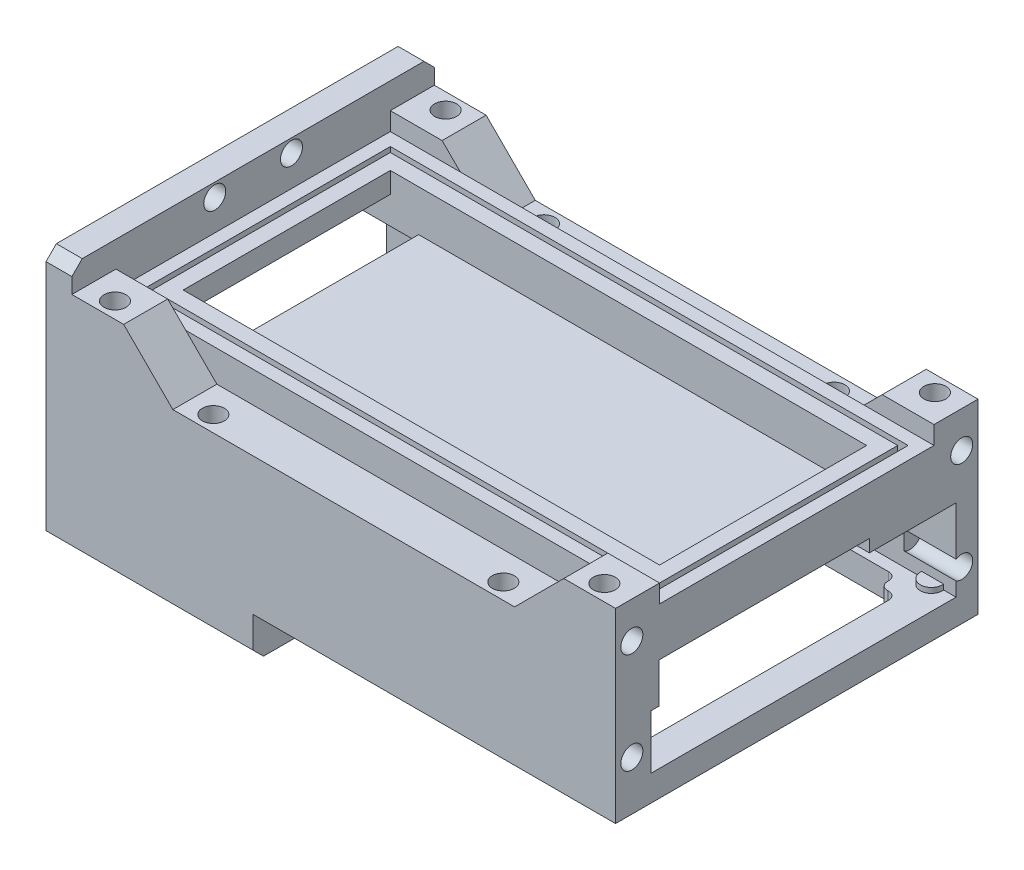
from build123d import *

# Parameters (mm, degrees)
BOSS_EXTRUDE1_DEPTH       = 70
SKETCH2_W                 = 53
SKETCH2_H                 = 3.5
CUT_EXTRUDE1_DEPTH        = 130.827770527
BOSS_EXTRUDE2_REACH       = 133.367
SKETCH3_W                 = 78
SKETCH3_H                 = 53
SKETCH4_W                 = 92
SKETCH4_H                 = 40
CUT_EXTRUDE2_DEPTH        = 8
CUT_EXTRUDE3_DEPTH        = 2
SKETCH6_W                 = 70
SKETCH6_H                 = 70
SKETCH6_W_2               = 44.924728749
SKETCH6_H_2               = 57.926731513
CUT_EXTRUDE4_DEPTH        = 9
CUT_EXTRUDE5_DEPTH        = 51
CUT_EXTRUDE6_REACH        = 131.946
CUT_EXTRUDE8_DEPTH        = 40
SKETCH12_W                = 70
SKETCH12_H                = 70
BOSS_EXTRUDE11_DEPTH      = 5
SKETCH13_R                = 2.125
CUT_EXTRUDE9_DEPTH        = 5
FILLET1_R                 = 1.5
SKETCH17_W                = 28
SKETCH17_H                = 16
CUT_EXTRUDE13_DEPTH       = 33
CUT_EXTRUDE14_DEPTH       = 2
FILLET2_R                 = 7.5
SKETCH19_W                = 70
SKETCH19_H                = 45
BOSS_EXTRUDE12_DEPTH      = 5
SKETCH20_W                = 40
SKETCH20_H                = 70
BOSS_EXTRUDE13_DEPTH      = 4
CHAMFER1_SIZE             = 2
SKETCH21_R                = 2.125
CUT_EXTRUDE15_DEPTH       = 5
SKETCH22_W                = 7.781971329
SKETCH22_H                = 26.560018154
BOSS_EXTRUDE14_DEPTH      = 14.5
SKETCH23_R                = 1.00000254
SKETCH23_W                = 2.87059736
SKETCH23_H                = 4.480571313
CUT_EXTRUDE16_DEPTH       = 5
CHAMFER2_SIZE             = 10
CHAMFER2_SIZE_2           = 14.4
CHAMFER3_SIZE             = 6
SKETCH24_R                = 2.125
CUT_EXTRUDE17_DEPTH       = 10
BOSS_EXTRUDE15_DEPTH      = 0.1
BOSS_EXTRUDE15_DEPTH_BACK = 1
SKETCH25_R                = 2.125
CUT_EXTRUDE18_START       = -9.5
SKETCH26_R                = 2.125
CUT_EXTRUDE18_DEPTH       = 5
SKETCH26_3_R              = 2.125
CUT_EXTRUDE19_DEPTH       = 5


with BuildPart() as part:
    # Sketch1 → Boss-Extrude1 (new body)
    with BuildSketch(Plane.XY):
        Polygon((-105, 9.5), (-95, 9.5), (-85.5, 0), (-19.5, 0), (-10, 9.5), (0, 9.5), (0, -30.5), (-105, -30.5), align=None)
    extrude(amount=-BOSS_EXTRUDE1_DEPTH)

    # Sketch2 → Cut-Extrude1 (cut, through all)
    with BuildSketch(Plane(origin=(0, 0, 0), x_dir=(0, 0, -1), z_dir=(1, 0, 0))):
        with Locations((35, 7.75)):
            Rectangle(SKETCH2_W, SKETCH2_H)
    extrude(amount=-CUT_EXTRUDE1_DEPTH, mode=Mode.SUBTRACT)

    # Sketch3 → Boss-Extrude2 (add, up to next)
    with BuildSketch(Plane(origin=(0, 6, 0), x_dir=(1, 0, 0), z_dir=(0, 1, 0)), mode=Mode.PRIVATE) as boss_extrude2_sk1:
        with Locations((-52.5, 35)):
            Rectangle(SKETCH3_W, SKETCH3_H)
    boss_extrude2_tool1 = extrude(boss_extrude2_sk1.sketch, amount=-BOSS_EXTRUDE2_REACH, mode=Mode.PRIVATE) - part.part
    add(boss_extrude2_tool1.solids().sort_by_distance((-52.5, 6, -35))[0])

    # Sketch4 → Cut-Extrude2 (cut)
    with BuildSketch(Plane(origin=(0, 6, 0), x_dir=(1, 0, 0), z_dir=(0, 1, 0))):
        with Locations((-52.5, 35)):
            Rectangle(SKETCH4_W, SKETCH4_H)
    extrude(amount=-CUT_EXTRUDE2_DEPTH, mode=Mode.SUBTRACT)

    # Sketch5 → Cut-Extrude3 (cut)
    with BuildSketch(Plane(origin=(0, 6, 0), x_dir=(1, 0, 0), z_dir=(0, 1, 0))):
        Polygon((-102.5, 11), (-91.5, 11), (-13.5, 11), (-2.5, 11), (-2.5, 59), (-13.5, 59), (-91.5, 59), (-102.5, 59), align=None)
        Polygon((-101.5, 12), (-91.5, 12), (-13.5, 12), (-3.5, 12), (-3.5, 58), (-13.5, 58), (-91.5, 58), (-101.5, 58), align=None, mode=Mode.SUBTRACT)
    extrude(amount=-CUT_EXTRUDE3_DEPTH, mode=Mode.SUBTRACT)

    # Sketch6 → Cut-Extrude4 (cut)
    # profile 1 of 2: a face of its own
    with BuildSketch(Plane(origin=(0, -30.5, 0), x_dir=(-1, 0, 0), z_dir=(0, -1, 0))):
        with Locations((35, 35)):
            Rectangle(SKETCH6_W, SKETCH6_H)
        with Locations((35.301172937, 35.02206094)):
            Rectangle(SKETCH6_W_2, SKETCH6_H_2, mode=Mode.SUBTRACT)
    # profile 2 of 2: a face of its own
    with BuildSketch(Plane(origin=(0, -30.5, 0), x_dir=(-1, 0, 0), z_dir=(0, -1, 0))):
        with Locations((35.301172937, 35.02206094)):
            Rectangle(SKETCH6_W_2, SKETCH6_H_2)
    extrude(amount=-CUT_EXTRUDE4_DEPTH, mode=Mode.SUBTRACT)

    # Sketch7 → Cut-Extrude5 (cut)
    with BuildSketch(Plane(origin=(0, 0, 0), x_dir=(0, 0, -1), z_dir=(1, 0, 0))):
        Polygon((65.756107057, -5.728262706), (49.01732031, -5.728262706), (49.01732031, -3.324369007), (8.399381402, -3.324369007), (8.399381402, -11.046594058), (6.843174338, -11.046594058), (6.843174338, -21.5), (65.756107057, -21.5), align=None)
    extrude(amount=-CUT_EXTRUDE5_DEPTH, mode=Mode.SUBTRACT)

    # Cut-Extrude6: up to this face of the body (flat: up to its plane)
    cut_extrude6_end = Plane(part.part.faces().sort_by_distance((-25.5, -3.324369007, -28.708350856))[0])
    # Sketch9 → Cut-Extrude6 (cut, up to the picked face)
    with BuildSketch(Plane.XZ.offset(21.5), mode=Mode.PRIVATE) as cut_extrude6_sk1:
        Polygon((-51, -6.843174338), (-73.873270861, -6.843174338), (-105, -6.843174338), (-105, -65.75), (-51, -65.75), align=None)
    cut_extrude6_tool1 = split(extrude(cut_extrude6_sk1.sketch, amount=-CUT_EXTRUDE6_REACH, mode=Mode.PRIVATE), bisect_by=cut_extrude6_end, keep=Keep.BOTH, mode=Mode.PRIVATE)
    add(cut_extrude6_tool1.solids().sort_by(Axis((-78, -21.5, -36.296587), (0, 1, 0)))[0], mode=Mode.SUBTRACT)

    # Sketch11 → Cut-Extrude8 (cut)
    with BuildSketch(Plane(origin=(0, 0, -15), x_dir=(-1, 0, 0), z_dir=(0, 0, -1))):
        Polygon((105, -2.637595748), (98.5, 2), (98.5, -2), (93.028116341, -2), (93.028116341, -11.163), (105, -11.163), align=None)
    extrude(amount=CUT_EXTRUDE8_DEPTH, mode=Mode.SUBTRACT)

    # Sketch12 → Boss-Extrude11 (add)
    with BuildSketch(Plane.XZ.offset(21.5)):
        with Locations((-35, -35)):
            Rectangle(SKETCH12_W, SKETCH12_H)
        Polygon((-59.75, -60.25), (-63, -60.25), (-63, -9.75), (-59.75, -9.75), (-59.75, -6.5), (-9.25, -6.5), (-9.25, -9.75), (-6, -9.75), (-6, -60.25), (-9.25, -60.25), (-9.25, -63.5), (-59.75, -63.5), align=None, mode=Mode.SUBTRACT)
    extrude(amount=BOSS_EXTRUDE11_DEPTH)

    # Sketch13 → Cut-Extrude9 (cut)
    with BuildSketch(Plane.XZ.offset(26.5)):
        with Locations((-65.5, -4.5)):
            Circle(SKETCH13_R)
        with Locations((-65.5, -65.5)):
            Circle(SKETCH13_R)
        with Locations((-4.5, -65.5)):
            Circle(SKETCH13_R)
        with Locations((-4.5, -4.5)):
            Circle(SKETCH13_R)
    extrude(amount=-CUT_EXTRUDE9_DEPTH, mode=Mode.SUBTRACT)

    # Fillet1
    # the kernel refuses this fillet: 1.5 mm, written as the material it adds along each edge
    with BuildSketch(Plane(origin=(-59.75, -21.5, -6.5), x_dir=(0, 0, -1), z_dir=(0, -1, 0)), Plane(origin=(-59.75, -21.5, -63.5), x_dir=(1, 0, 0), z_dir=(0, -1, 0)), Plane(origin=(-63, -21.5, -60.25), x_dir=(1, 0, 0), z_dir=(0, -1, 0)), Plane(origin=(-63, -21.5, -9.75), x_dir=(0, 0, -1), z_dir=(0, -1, 0))) as fillet1_piece_1:
        with BuildLine():
            CenterArc((FILLET1_R, FILLET1_R), FILLET1_R, 180, 90)
            Line((0, FILLET1_R), (0, 0))
            Line((0, 0), (FILLET1_R, 0))
        make_face()
    extrude(amount=5)
    with BuildSketch(Plane(origin=(-9.25, -21.5, -6.5), x_dir=(0, 0, -1), z_dir=(0, -1, 0)), Plane(origin=(-6, -21.5, -9.75), x_dir=(0, 0, -1), z_dir=(0, -1, 0)), Plane(origin=(-6, -21.5, -60.25), x_dir=(-1, 0, 0), z_dir=(0, -1, 0)), Plane(origin=(-9.25, -21.5, -63.5), x_dir=(-1, 0, 0), z_dir=(0, -1, 0))) as fillet1_piece_2:
        with BuildLine():
            CenterArc((FILLET1_R, -FILLET1_R), FILLET1_R, 90, 90)
            Line((0, -FILLET1_R), (0, 0))
            Line((0, 0), (FILLET1_R, 0))
        make_face()
    extrude(amount=5)
    # the kernel refuses this fillet: 1.5 mm, written as the material it takes off along each edge
    with BuildSketch(Plane(origin=(-9.25, -17.75, -9.75), x_dir=(1, 0, 0), z_dir=(0, -1, 0)), Plane(origin=(-9.25, -17.75, -60.25), x_dir=(0, 0, -1), z_dir=(0, -1, 0)), Plane(origin=(-59.75, -17.75, -60.25), x_dir=(-1, 0, 0), z_dir=(0, -1, 0)), Plane(origin=(-59.75, -17.75, -9.75), x_dir=(0, 0, 1), z_dir=(0, -1, 0))) as fillet1_2_piece_1:
        with BuildLine():
            CenterArc((FILLET1_R, FILLET1_R), FILLET1_R, 180, 90)
            Line((0, FILLET1_R), (0, 0))
            Line((0, 0), (FILLET1_R, 0))
        make_face()
    extrude(amount=12.5, mode=Mode.SUBTRACT)

    # Sketch17 → Cut-Extrude13 (cut)
    with BuildSketch(Plane.ZY.offset(105)):
        with Locations((-51.75, -17.477481475)):
            Rectangle(SKETCH17_W, SKETCH17_H)
    extrude(amount=-CUT_EXTRUDE13_DEPTH, mode=Mode.SUBTRACT)

    # Sketch18 → Cut-Extrude14 (cut)
    with BuildSketch(Plane.XZ.offset(26.5)):
        with BuildLine():
            ThreePointArc((-58.25, -4), (-60.822923475, -4.937310856), (-62.190032397, -7.309967603))
            ThreePointArc((-62.190032397, -7.309967603), (-64.562689144, -8.677076525), (-65.5, -11.25))
            Line((-65.5, -11.25), (-65.5, -58.75))
            ThreePointArc((-65.5, -58.75), (-64.562689144, -61.322923475), (-62.190032397, -62.690032397))
            ThreePointArc((-62.190032397, -62.690032397), (-60.822923475, -65.062689144), (-58.25, -66))
            Line((-58.25, -66), (-10.75, -66))
            ThreePointArc((-10.75, -66), (-8.177076525, -65.062689144), (-6.809967603, -62.690032397))
            ThreePointArc((-6.809967603, -62.690032397), (-4.437310856, -61.322923475), (-3.5, -58.75))
            Line((-3.5, -58.75), (-3.5, -11.25))
            ThreePointArc((-3.5, -11.25), (-4.437310856, -8.677076525), (-6.809967603, -7.309967603))
            ThreePointArc((-6.809967603, -7.309967603), (-8.177076525, -4.937310856), (-10.75, -4))
            Line((-10.75, -4), (-58.25, -4))
        make_face()
        with BuildLine():
            ThreePointArc((-61.5, -8.25), (-63.621320344, -9.128679656), (-64.5, -11.25))
            Line((-64.5, -11.25), (-64.5, -58.75))
            ThreePointArc((-64.5, -58.75), (-63.621320344, -60.871320344), (-61.5, -61.75))
            Line((-61.5, -61.75), (-61.25, -61.75))
            Line((-61.25, -61.75), (-61.25, -62))
            ThreePointArc((-61.25, -62), (-60.371320344, -64.121320344), (-58.25, -65))
            Line((-58.25, -65), (-10.75, -65))
            ThreePointArc((-10.75, -65), (-8.628679656, -64.121320344), (-7.75, -62))
            Line((-7.75, -62), (-7.75, -61.75))
            Line((-7.75, -61.75), (-7.5, -61.75))
            ThreePointArc((-7.5, -61.75), (-5.378679656, -60.871320344), (-4.5, -58.75))
            Line((-4.5, -58.75), (-4.5, -11.25))
            ThreePointArc((-4.5, -11.25), (-5.378679656, -9.128679656), (-7.5, -8.25))
            Line((-7.5, -8.25), (-7.75, -8.25))
            Line((-7.75, -8.25), (-7.75, -8))
            ThreePointArc((-7.75, -8), (-8.628679656, -5.878679656), (-10.75, -5))
            Line((-10.75, -5), (-58.25, -5))
            ThreePointArc((-58.25, -5), (-60.371320344, -5.878679656), (-61.25, -8))
            Line((-61.25, -8), (-61.25, -8.25))
            Line((-61.25, -8.25), (-61.5, -8.25))
        make_face(mode=Mode.SUBTRACT)
    extrude(amount=-CUT_EXTRUDE14_DEPTH, mode=Mode.SUBTRACT)

    # Fillet2
    fillet2_edges = [part.edges().sort_by_distance(p)[0] for p in [
        (-6.809967603, -25.5, -7.309967603),
        (-62.190032397, -25.5, -7.309967603),
        (-61.25, -25.5, -61.75),
        (-7.75, -25.5, -61.75),
        (-7.75, -25.5, -8.25),
        (-61.25, -25.5, -8.25),
        (-6.809967603, -25.5, -62.690032397),
        (-62.190032397, -25.5, -62.690032397),
    ]]
    fillet(fillet2_edges, radius=FILLET2_R)

    # Sketch19 → Boss-Extrude12 (add)
    with BuildSketch(Plane(origin=(-105, 0, 0), x_dir=(0, 0, -1), z_dir=(1, 0, 0))):
        with Locations((35, -8)):
            Rectangle(SKETCH19_W, SKETCH19_H)
        Polygon((55, -2.637595748), (55, -3.324369007), (65.75, -3.324369007), (65.75, -25.477481475), (37.75, -25.477481475), (37.75, -21.5), (6.843174338, -21.5), (6.843174338, -3.324369007), (15, -3.324369007), (15, -2.637595748), align=None, mode=Mode.SUBTRACT)
    extrude(amount=-BOSS_EXTRUDE12_DEPTH)

    # Sketch20 → Boss-Extrude13 (add)
    with BuildSketch(Plane.XZ.offset(30.5)):
        with Locations((-90, -35)):
            Rectangle(SKETCH20_W, SKETCH20_H)
    extrude(amount=BOSS_EXTRUDE13_DEPTH)

    # Chamfer1
    chamfer1_edges = [part.edges().sort_by_distance(p)[0] for p in [
        (-107.5, 14.5, 0),
        (-107.5, 14.5, -70),
        (-90, -34.5, -70),
        (-90, -34.5, 0),
    ]]
    chamfer(chamfer1_edges, length=CHAMFER1_SIZE)

    # Sketch21 → Cut-Extrude15 (cut)
    with BuildSketch(Plane.ZY.offset(110)):
        with Locations((-67.511138893, -10.190690634)):
            Circle(SKETCH21_R)
        with Locations((-67.511138893, -31.977409845)):
            Circle(SKETCH21_R)
        with Locations((-43.088444633, -31.853936802)):
            Circle(SKETCH21_R)
        with Locations((-26.911555367, -31.853936802)):
            Circle(SKETCH21_R)
        with Locations((-2.488861107, -31.977409845)):
            Circle(SKETCH21_R)
        with Locations((-2.488861107, -10.190690634)):
            Circle(SKETCH21_R)
        with Locations((-27.588730982, 11.943276067)):
            Circle(SKETCH21_R)
        with Locations((-42.411269018, 11.943276067)):
            Circle(SKETCH21_R)
    extrude(amount=-CUT_EXTRUDE15_DEPTH, mode=Mode.SUBTRACT)

    # Sketch22 → Boss-Extrude14 (add)
    with BuildSketch(Plane.XZ.offset(3.324369007)):
        with Locations((-61.060131517, -36.915965033)):
            Rectangle(SKETCH22_W, SKETCH22_H)
    extrude(amount=BOSS_EXTRUDE14_DEPTH)

    # Sketch23 → Cut-Extrude16 (cut)
    with BuildSketch(Plane.XZ.offset(17.824369007)):
        with Locations((-61.319618122, -47.484834911)):
            Circle(SKETCH23_R)
        with Locations((-61.319618122, -26.484791731)):
            Circle(SKETCH23_R)
        with Locations((-58.604444532, -25.876241613)):
            Rectangle(SKETCH23_W, SKETCH23_H)
    extrude(amount=-CUT_EXTRUDE16_DEPTH, mode=Mode.SUBTRACT)

    # Chamfer2
    # the kernel refuses this chamfer: 14.4, 10 mm, written as the material it adds along each edge
    with BuildSketch(Plane(origin=(-57.169145852, -3.324369007, -50.19597411), x_dir=(0.9989525548312027, 0.04575798505411994, 0), z_dir=(0, 0, 1))) as chamfer2_piece_1_section:
        Polygon((CHAMFER2_SIZE * 0.998952554831, -CHAMFER2_SIZE * 0.0457579850541), (-CHAMFER2_SIZE_2 * 0.0457579850541, -CHAMFER2_SIZE_2 * 0.998952554831), (0, 0), align=None)
    chamfer2_piece_1 = extrude(amount=26.560018153, mode=Mode.PRIVATE)
    chamfer2_piece_1 = split(chamfer2_piece_1, bisect_by=Plane(origin=(-50.279505492, -12.824369007, -49.60664721), z_dir=(0, 1, 0)), keep=Keep.TOP, mode=Mode.PRIVATE)
    add(chamfer2_piece_1)
    with BuildSketch(Plane(origin=(-57.169145852, -3.324369007, -50.19597411), x_dir=(0.9989525548312027, 0.04575798505411994, 0), z_dir=(0, 0, 1))) as chamfer2_piece_2_section:
        Polygon((CHAMFER2_SIZE * 0.998952554831, -CHAMFER2_SIZE * 0.0457579850541), (-CHAMFER2_SIZE_2 * 0.0457579850541, -CHAMFER2_SIZE_2 * 0.998952554831), (0, 0), align=None)
    chamfer2_piece_2 = extrude(amount=63.751861856, mode=Mode.PRIVATE)
    chamfer2_piece_2 = split(chamfer2_piece_2, bisect_by=Plane(origin=(-56.034886592, -14.457702341, -28.116527269), z_dir=(0, 0, -1)), keep=Keep.TOP, mode=Mode.PRIVATE)
    add(chamfer2_piece_2)

    # Chamfer3
    # the kernel refuses this chamfer: 6 mm, written as the material it takes off along each edge
    with BuildSketch(Plane(origin=(-38.367882654, 9.349449998, -23.635955956), x_dir=(0.02258428722779286, -0.01568353279708172, -0.9996219169112968), z_dir=(-0.5703958094954263, -0.8213699656732387, 0))) as chamfer3_piece_1_section:
        Polygon((CHAMFER3_SIZE * 0.999621916911, -CHAMFER3_SIZE * 0.0274958766106), (-CHAMFER3_SIZE * 0.0274958766106, -CHAMFER3_SIZE * 0.999621916911), (0, 0), align=None)
    chamfer3_piece_1 = extrude(amount=42.426238439, mode=Mode.PRIVATE)
    chamfer3_piece_1 = split(chamfer3_piece_1, bisect_by=Plane(origin=(-60.039743212, -8.074369007, -28.623003498), z_dir=(1, 0, 0)), keep=Keep.TOP, mode=Mode.PRIVATE)
    chamfer3_piece_1 = split(chamfer3_piece_1, bisect_by=Plane(origin=(-51.084380714, -12.824369007, -28.623003498), z_dir=(0, 1, 0)), keep=Keep.TOP, mode=Mode.PRIVATE)
    chamfer3_piece_1 = split(chamfer3_piece_1, bisect_by=Plane(origin=(-51.084380714, -3.324369007, -28.623003498), z_dir=(0, -1, 0)), keep=Keep.TOP, mode=Mode.PRIVATE)
    add(chamfer3_piece_1, mode=Mode.SUBTRACT)
    with BuildSketch(Plane(origin=(-38.367882654, 9.349449998, -23.635955956), x_dir=(0.02258428722779286, -0.01568353279708172, -0.9996219169112968), z_dir=(-0.5703958094954263, -0.8213699656732387, 0))) as chamfer3_piece_2_section:
        Polygon((CHAMFER3_SIZE * 0.999621916911, -CHAMFER3_SIZE * 0.0274958766106), (-CHAMFER3_SIZE * 0.0274958766106, -CHAMFER3_SIZE * 0.999621916911), (0, 0), align=None)
    chamfer3_piece_2 = extrude(amount=42.426238439, mode=Mode.PRIVATE)
    chamfer3_piece_2 = split(chamfer3_piece_2, bisect_by=Plane(origin=(-57.169145852, -14.879528901, -28.651026471), z_dir=(1, 0, 0)), keep=Keep.TOP, mode=Mode.PRIVATE)
    chamfer3_piece_2 = split(chamfer3_piece_2, bisect_by=Plane(origin=(-55.741951481, -3.324369007, -28.651026471), z_dir=(0, -1, 0)), keep=Keep.TOP, mode=Mode.PRIVATE)
    add(chamfer3_piece_2, mode=Mode.SUBTRACT)

    # Sketch24 → Cut-Extrude17 (cut)
    with BuildSketch(Plane(origin=(0, 0, 0), x_dir=(0, 0, -1), z_dir=(1, 0, 0))):
        with Locations(Location((3.144372855, -16.972338166, 0), (0, 0, 90))):
            Circle(SKETCH24_R)
        with Locations(Location((3.144372855, 2.484053438, 0), (0, 0, 90))):
            Circle(SKETCH24_R)
        with Locations(Location((66.855627145, 2.484053438, 0), (0, 0, 90))):
            Circle(SKETCH24_R)
        with Locations((66.855627145, -16.972338166)):
            Circle(SKETCH24_R)
    extrude(amount=-CUT_EXTRUDE17_DEPTH, mode=Mode.SUBTRACT)

    # Sketch25 → Boss-Extrude15 (add, two sides: drawn at the far end of the back side and taken through both)
    with BuildSketch(Plane.XZ.offset(21.5).offset(-BOSS_EXTRUDE15_DEPTH_BACK)):
        with Locations((-65.5, -65.5)):
            Circle(SKETCH25_R)
        with Locations((-4.5, -65.5)):
            Circle(SKETCH25_R)
    extrude(amount=BOSS_EXTRUDE15_DEPTH + BOSS_EXTRUDE15_DEPTH_BACK)

    # Sketch26 → Cut-Extrude18 (cut)
    with BuildSketch(Plane(origin=(0, 9.5, 0), x_dir=(1, 0, 0), z_dir=(0, 1, 0)).offset(CUT_EXTRUDE18_START)):
        with Locations(Location((-24.757359313, 66.925, 0), (0, 0, 180))):
            Circle(SKETCH26_R)
        with Locations(Location((-80.757359313, 66.925, 0), (0, 0, 180))):
            Circle(SKETCH26_R)
        with Locations(Location((-80.757359313, 3.075, 0), (0, 0, 180))):
            Circle(SKETCH26_R)
        with Locations(Location((-24.757359313, 3.075, 0), (0, 0, 180))):
            Circle(SKETCH26_R)
    extrude(amount=-CUT_EXTRUDE18_DEPTH, mode=Mode.SUBTRACT)

    # Sketch26<3> → Cut-Extrude19 (cut)
    with BuildSketch(Plane(origin=(0, 9.5, 0), x_dir=(1, 0, 0), z_dir=(0, 1, 0))):
        with Locations(Location((-99.75, 3.075, 0), (0, 0, 180))):
            Circle(SKETCH26_3_R)
        with Locations(Location((-99.75, 66.925, 0), (0, 0, 180))):
            Circle(SKETCH26_3_R)
        with Locations(Location((-5.25, 66.925, 0), (0, 0, 180))):
            Circle(SKETCH26_3_R)
        with Locations(Location((-5.25, 3.075, 0), (0, 0, 180))):
            Circle(SKETCH26_3_R)
    extrude(amount=-CUT_EXTRUDE19_DEPTH, mode=Mode.SUBTRACT)


solid = part.part
